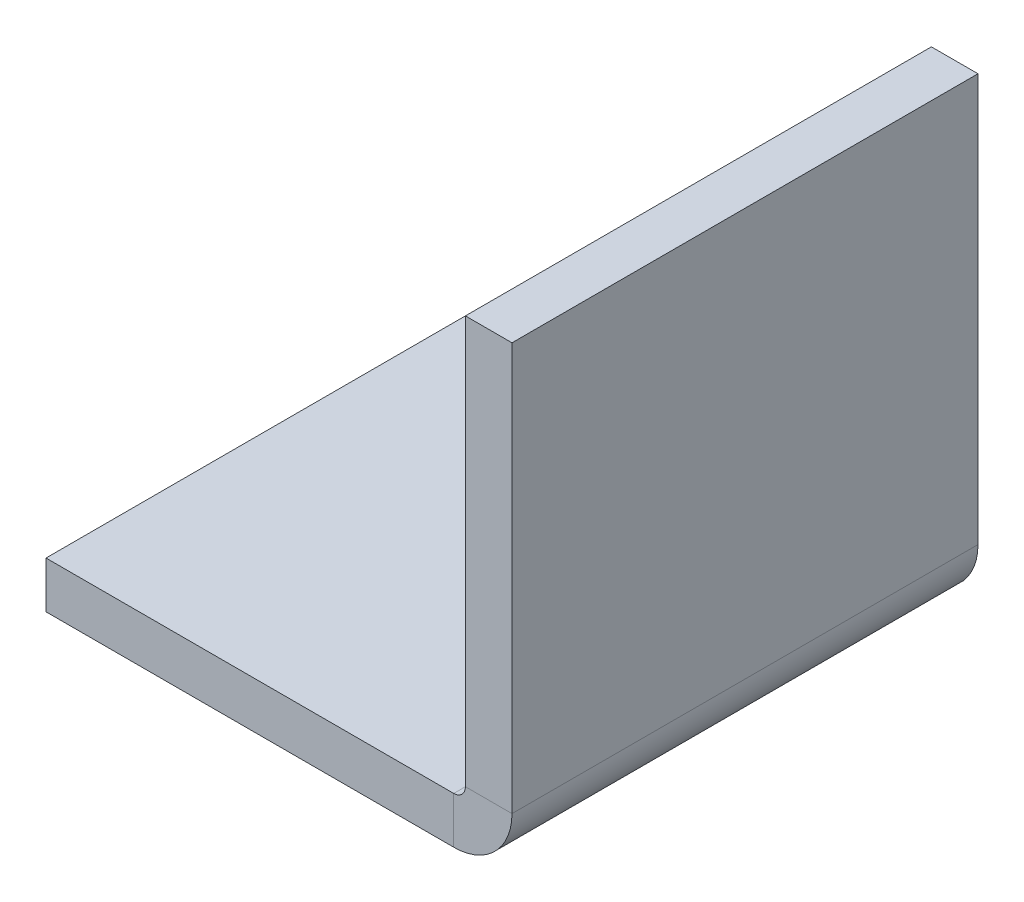
from build123d import *

# Parameters (mm, degrees)
SKETCH1_W                    = 40
SKETCH1_H                    = 40
BASE_FLANGE1_DEPTH           = 4
EDGE_FLANGE1_STRIP_W         = 18
EDGE_FLANGE1_STRIP_H         = 4
EDGE_FLANGE1_STRIP_CUT_DEPTH = 40
EDGE_FLANGE1_DEPTH           = 40


# Sheet-metal steps are written as plain solids
with BuildPart() as part:
    # Sketch1 → Base-Flange1 (new body)
    with BuildSketch(Plane(origin=(0, 0, 0), x_dir=(1, 0, 0), z_dir=(0, 1, 0))):
        Rectangle(SKETCH1_W, SKETCH1_H)
    extrude(amount=-BASE_FLANGE1_DEPTH)

    # Edge-Flange1 strip (across the edge) → Edge-Flange1 strip cut (cut)
    with BuildSketch(Plane(origin=(20, 0, 20), x_dir=(-1, 0, 0), z_dir=(0, 0, -1))):
        with Locations((-4, -2)):
            Rectangle(EDGE_FLANGE1_STRIP_W, EDGE_FLANGE1_STRIP_H)
    extrude(amount=EDGE_FLANGE1_STRIP_CUT_DEPTH, mode=Mode.SUBTRACT)

    # Edge-Flange1 section (across the edge) → Edge-Flange1 (add)
    with BuildSketch(Plane(origin=(20, 0, 20), x_dir=(-1, 0, 0), z_dir=(0, 0, -1))):
        with BuildLine():
            Line((0, 1), (0, 36))
            Line((0, 36), (4, 36))
            Line((4, 36), (4, 1))
            ThreePointArc((4, 1), (4.292893219, 0.292893219), (5, 0))
            Line((5, 0), (5, -4))
            ThreePointArc((5, -4), (1.464466094, -2.535533906), (0, 1))
        make_face()
    extrude(amount=EDGE_FLANGE1_DEPTH)


solid = part.part
